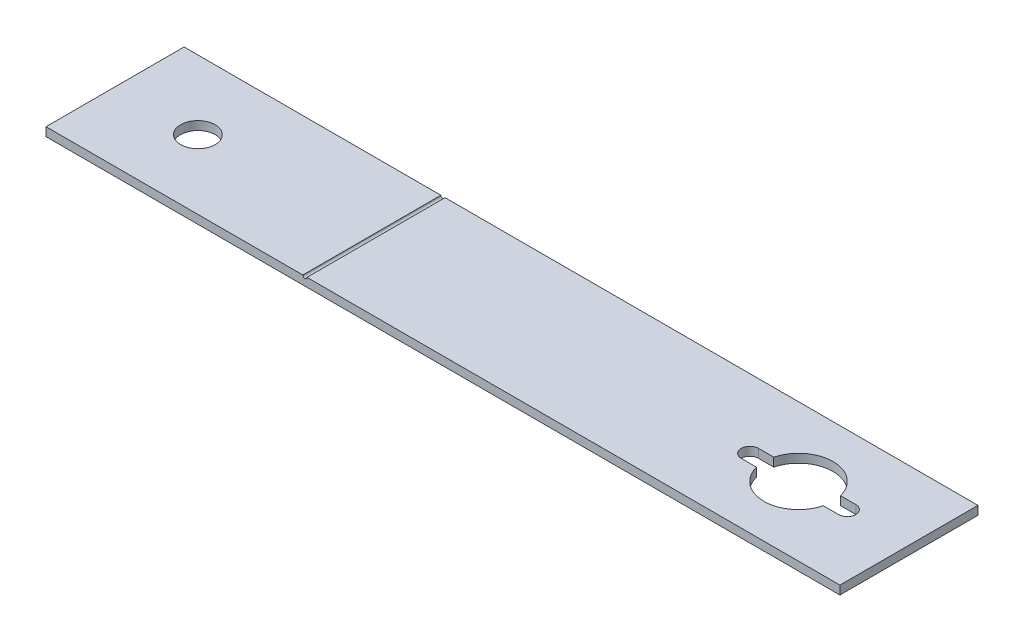
from build123d import *

# Parameters (mm, degrees)
SKETCH1_W          = 146.05
SKETCH1_H          = 25.4
BASE_FLANGE1_DEPTH = 1.5875
SKETCH6_R          = 3.175
CUT_EXTRUDE1_DEPTH = 2.54
CUT_EXTRUDE3_DEPTH = 2.54
SKETCH10_R         = 0.381
CUT_EXTRUDE4_DEPTH = 25.654


# Sheet-metal steps are written as plain solids
with BuildPart() as part:
    # Sketch1 → Base-Flange1 (new body)
    with BuildSketch(Plane(origin=(0, 0, 0), x_dir=(1, 0, 0), z_dir=(0, 1, 0))):
        Rectangle(SKETCH1_W, SKETCH1_H)
    extrude(amount=-BASE_FLANGE1_DEPTH)

    # Sketch6 → Cut-Extrude1 (cut)
    with BuildSketch(Plane(origin=(0, 0, 0), x_dir=(1, 0, 0), z_dir=(0, 1, 0))):
        with Locations(Location((-57.785, 0, 0), (0, 0, 270))):
            Circle(SKETCH6_R)
    extrude(amount=-CUT_EXTRUDE1_DEPTH, mode=Mode.SUBTRACT)

    # Sketch8 → Cut-Extrude3 (cut)
    with BuildSketch(Plane(origin=(0, 0, 0), x_dir=(1, 0, 0), z_dir=(0, 1, 0))):
        with BuildLine():
            Line((43.7515, 1.5875), (46.556638938, 1.5875))
            ThreePointArc((46.556638938, 1.5875), (52.705, 6.35), (58.853361062, 1.5875))
            Line((58.853361062, 1.5875), (61.6585, 1.5875))
            ThreePointArc((61.6585, 1.5875), (63.246, 0), (61.6585, -1.5875))
            Line((61.6585, -1.5875), (58.853361062, -1.5875))
            ThreePointArc((58.853361062, -1.5875), (52.705, -6.35), (46.556638938, -1.5875))
            Line((46.556638938, -1.5875), (43.7515, -1.5875))
            ThreePointArc((43.7515, -1.5875), (42.164, 0), (43.7515, 1.5875))
        make_face()
    extrude(amount=-CUT_EXTRUDE3_DEPTH, mode=Mode.SUBTRACT)

    # Sketch10 → Cut-Extrude4 (cut)
    with BuildSketch(Plane.XY.offset(12.7)):
        with Locations((-25.398772406, 0)):
            Circle(SKETCH10_R)
    extrude(amount=-CUT_EXTRUDE4_DEPTH, mode=Mode.SUBTRACT)


solid = part.part
